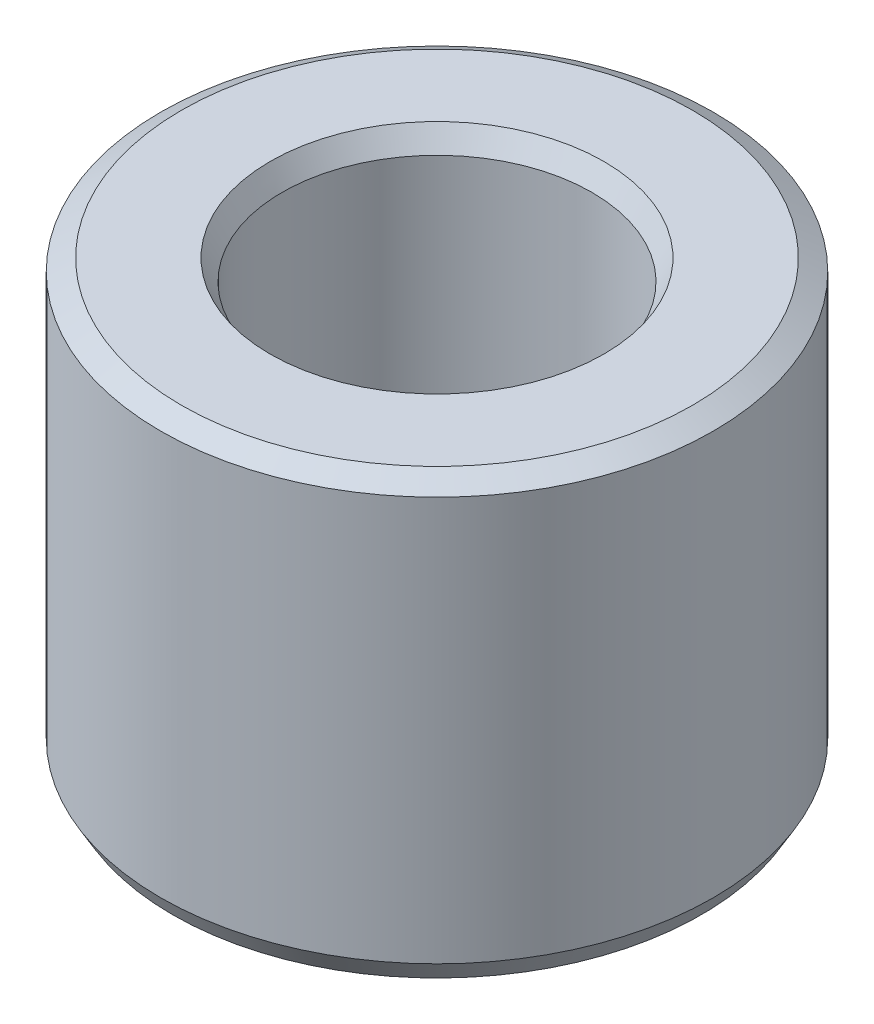
from build123d import *
from OCP.BRepFilletAPI import BRepFilletAPI_MakeChamfer

# Parameters (mm, degrees)
SKETCH1_R           = 55
BOSS_EXTRUDE1_DEPTH = 86.957125183
SKETCH2_R           = 30.832018257
CUT_EXTRUDE1_DEPTH  = 117.66851169
CHAMFER1_SIZE       = 2.385850321
CHAMFER1_SIZE2      = 4.132413976


with BuildPart() as part:
    # Sketch1 → Boss-Extrude1 (new body)
    with BuildSketch(Plane(origin=(0, 0, 0), x_dir=(1, 0, 0), z_dir=(0, 1, 0))):
        Circle(SKETCH1_R)
    extrude(amount=BOSS_EXTRUDE1_DEPTH)

    # Sketch2 → Cut-Extrude1 (cut, through all)
    with BuildSketch(Plane(origin=(0, 0, 0), x_dir=(1, 0, 0), z_dir=(0, 1, 0))):
        Circle(SKETCH2_R)
    extrude(amount=CUT_EXTRUDE1_DEPTH, mode=Mode.SUBTRACT)

    # Chamfer1: one chamfer whose edges measure the first distance from different faces: ONE call of the kernel's chamfer builder (chamfer() names one face for all edges)
    chamfer1_edges_1 = [part.edges().sort_by_distance(p)[0] for p in [
        (-30.832018257, 86.957125183, 0),
    ]]
    chamfer1_side_1 = [part.faces().sort_by_distance(p)[0] for p in [
        (-53.444365081, 86.957125183, 0),
    ]]
    chamfer1_edges_2 = [part.edges().sort_by_distance(p)[0] for p in [
        (-30.832018257, 0, 0),
    ]]
    chamfer1_side_2 = [part.faces().sort_by_distance(p)[0] for p in [
        (-30.832018257, 43.478562591, 0),
    ]]
    chamfer1_edges_3 = [part.edges().sort_by_distance(p)[0] for p in [
        (-55, 0, 0),
    ]]
    chamfer1_side_3 = [part.faces().sort_by_distance(p)[0] for p in [
        (-53.444365081, 0, 0),
    ]]
    chamfer1_edges_4 = [part.edges().sort_by_distance(p)[0] for p in [
        (-55, 86.957125183, 0),
    ]]
    chamfer1_side_4 = [part.faces().sort_by_distance(p)[0] for p in [
        (-55, 43.478562591, 0),
    ]]
    chamfer1 = BRepFilletAPI_MakeChamfer(part.part.solid().wrapped)
    for e in chamfer1_edges_1:
        chamfer1.Add(CHAMFER1_SIZE, CHAMFER1_SIZE2, e.wrapped, chamfer1_side_1[0].wrapped)  # the first distance lies on this face
    for e in chamfer1_edges_2:
        chamfer1.Add(CHAMFER1_SIZE, CHAMFER1_SIZE2, e.wrapped, chamfer1_side_2[0].wrapped)  # the first distance lies on this face
    for e in chamfer1_edges_3:
        chamfer1.Add(CHAMFER1_SIZE, CHAMFER1_SIZE2, e.wrapped, chamfer1_side_3[0].wrapped)  # the first distance lies on this face
    for e in chamfer1_edges_4:
        chamfer1.Add(CHAMFER1_SIZE, CHAMFER1_SIZE2, e.wrapped, chamfer1_side_4[0].wrapped)  # the first distance lies on this face
    add(Compound.cast(chamfer1.Shape()), mode=Mode.REPLACE)


solid = part.part
